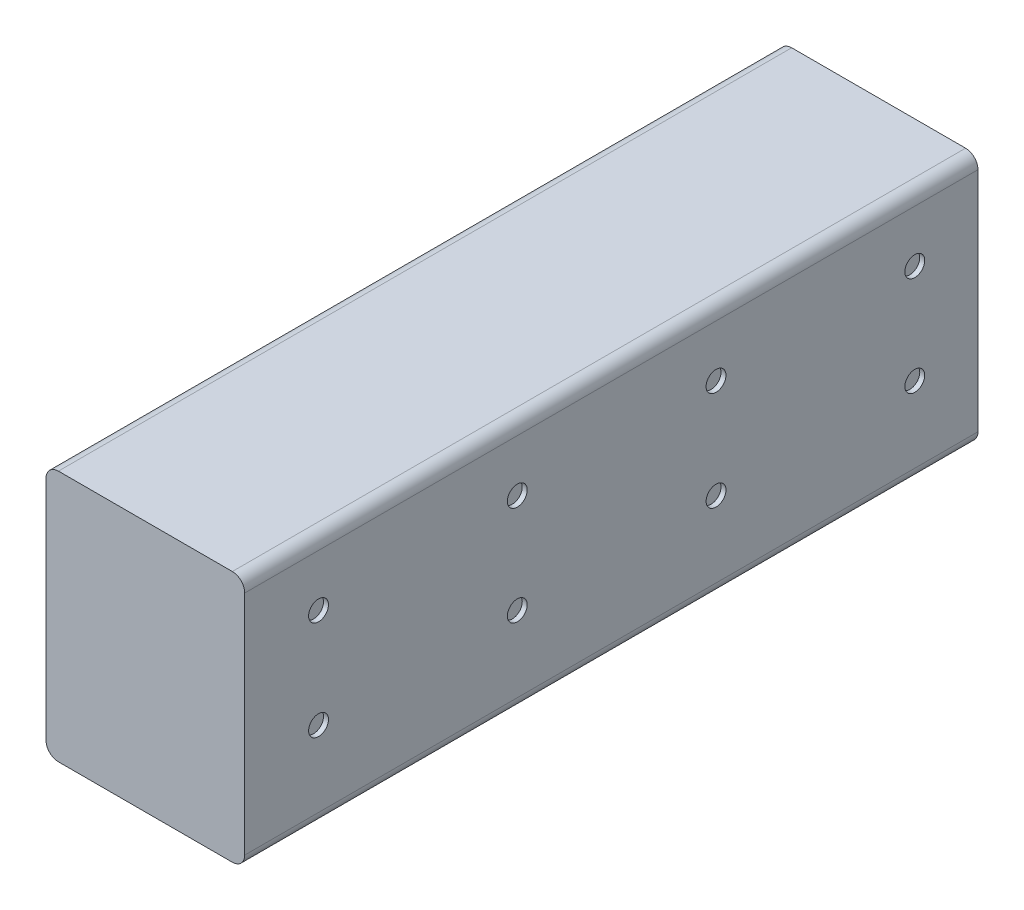
from build123d import *

# Parameters (mm, degrees)
SKETCH2_W           = 80
SKETCH2_H           = 101.346
BOSS_EXTRUDE1_DEPTH = 295.148
SKETCH3_R           = 4
CUT_EXTRUDE1_DEPTH  = 2
FILLET3_R           = 5
FILLET4_R           = 5
FILLET5_R           = 5
FILLET6_R           = 5


with BuildPart() as part:
    # Sketch2 → Boss-Extrude1 (new body)
    with BuildSketch(Plane.XY):
        with Locations((40, 50.673)):
            Rectangle(SKETCH2_W, SKETCH2_H)
    extrude(amount=BOSS_EXTRUDE1_DEPTH)

    # Sketch3 → Cut-Extrude1 (cut)
    with BuildSketch(Plane(origin=(80, 0, 0), x_dir=(0, 0, -1), z_dir=(1, 0, 0))):
        with Locations((-265.445597479, 75.450765932)):
            Circle(SKETCH3_R)
        with Locations((-185.445597479, 75.450765932)):
            Circle(SKETCH3_R)
        with Locations((-105.445597479, 75.450765932)):
            Circle(SKETCH3_R)
        with Locations((-25.445597479, 75.450765932)):
            Circle(SKETCH3_R)
        with Locations((-185.445597479, 35.450765932)):
            Circle(SKETCH3_R)
        with Locations((-105.445597479, 35.450765932)):
            Circle(SKETCH3_R)
        with Locations((-25.445597479, 35.450765932)):
            Circle(SKETCH3_R)
        with Locations((-265.445597479, 35.450765932)):
            Circle(SKETCH3_R)
    cut_extrude1 = extrude(amount=-CUT_EXTRUDE1_DEPTH, mode=Mode.SUBTRACT)

    # Mirror1: Cut-Extrude1 across plane
    add(cut_extrude1.mirror(Plane.ZY.offset(-40)), mode=Mode.SUBTRACT)

    # Fillet3
    fillet3_edges = [part.edges().sort_by_distance(p)[0] for p in [
        (0, 101.346, 147.574),
    ]]
    fillet(fillet3_edges, radius=FILLET3_R)

    # Fillet4
    fillet4_edges = [part.edges().sort_by_distance(p)[0] for p in [
        (80, 101.346, 147.574),
    ]]
    fillet(fillet4_edges, radius=FILLET4_R)

    # Fillet5
    fillet5_edges = [part.edges().sort_by_distance(p)[0] for p in [
        (0, 0, 147.574),
    ]]
    fillet(fillet5_edges, radius=FILLET5_R)

    # Fillet6
    fillet6_edges = [part.edges().sort_by_distance(p)[0] for p in [
        (80, 0, 147.574),
    ]]
    fillet(fillet6_edges, radius=FILLET6_R)


solid = part.part
